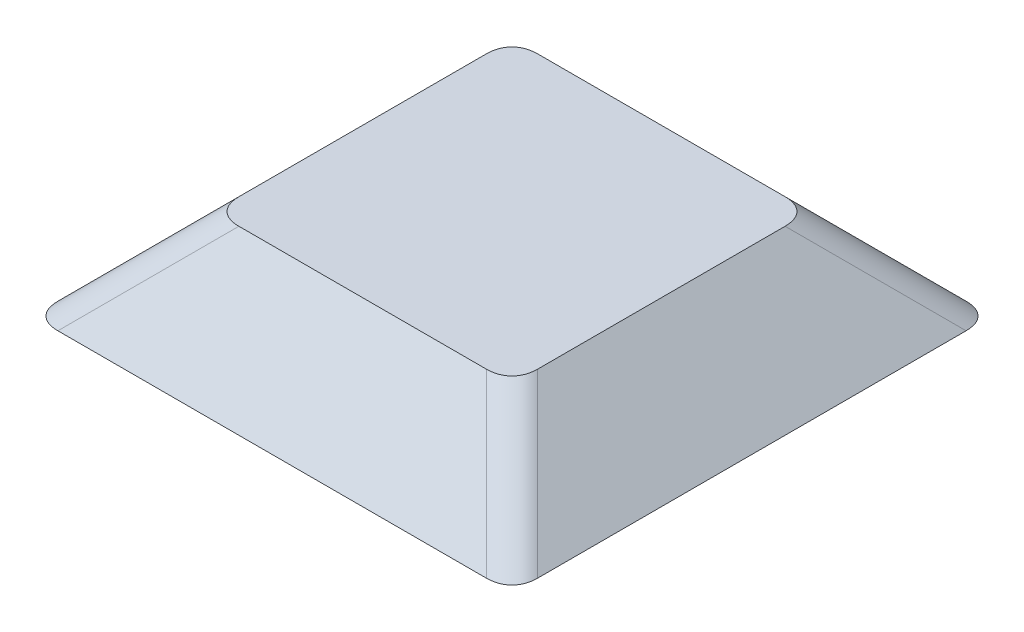
from build123d import *

# Parameters (mm, degrees)
SKETCH1_W           = 106
SKETCH1_H           = 106
BOSS_EXTRUDE1_DEPTH = 20
CHAMFER3_SIZE       = 20
FILLET1_R           = 8


# Some blends are built 0.0001 mm under size
with BuildPart() as part:
    # Sketch1 → Boss-Extrude1 (new body)
    with BuildSketch(Plane(origin=(0, 0, 0), x_dir=(1, 0, 0), z_dir=(0, 1, 0))):
        Rectangle(SKETCH1_W, SKETCH1_H)
    extrude(amount=BOSS_EXTRUDE1_DEPTH)

    # Chamfer3
    chamfer3_edges = [part.edges().sort_by_distance(p)[0] for p in [
        (-53, 20, 0),
        (0, 20, -53),
        (53, 20, 0),
        (0, 20, 53),
    ]]
    chamfer(chamfer3_edges, length=CHAMFER3_SIZE - 0.0001)  # a hair under: the kernel refuses the full size

    # Fillet1
    # the kernel refuses this fillet: 8 mm, written as the material it takes off along each edge
    with BuildSketch(Plane(origin=(59.666666667, -6.666566667, -59.666666667), x_dir=(-0.8164965809277259, -0.4082482904638644, -0.40824829046386174), z_dir=(-0.5773502691896258, 0.5773502691896258, 0.5773502691896256)), Plane(origin=(59.666666667, -6.666566667, 59.666666667), x_dir=(0.40824829046386324, -0.40824829046386285, -0.8164965809277259), z_dir=(-0.5773502691896257, 0.577350269189626, -0.577350269189626))) as fillet1_piece_1:
        with BuildLine():
            CenterArc((FILLET1_R * 0.57735026919, FILLET1_R), FILLET1_R, 210, 60)
            Line((-FILLET1_R * 0.288675134595, FILLET1_R * 0.5), (0, 0))
            Line((0, 0), (FILLET1_R * 0.57735026919, 0))
        make_face()
    extrude(amount=57.734853714, mode=Mode.SUBTRACT)
    with BuildSketch(Plane(origin=(-59.666666667, -6.666566667, -59.666666667), x_dir=(0.8164965809277261, -0.4082482904638631, -0.4082482904638627), z_dir=(0.5773502691896256, 0.5773502691896257, 0.577350269189626)), Plane(origin=(-59.666666667, -6.666566667, 59.666666667), x_dir=(-0.4082482904638621, -0.40824829046386396, -0.816496580927726), z_dir=(0.5773502691896257, 0.5773502691896258, -0.5773502691896257))) as fillet1_piece_2:
        with BuildLine():
            CenterArc((FILLET1_R * 0.57735026919, -FILLET1_R), FILLET1_R, 90, 60)
            Line((-FILLET1_R * 0.288675134595, -FILLET1_R * 0.5), (0, 0))
            Line((0, 0), (FILLET1_R * 0.57735026919, 0))
        make_face()
    extrude(amount=57.734853714, mode=Mode.SUBTRACT)


solid = part.part
